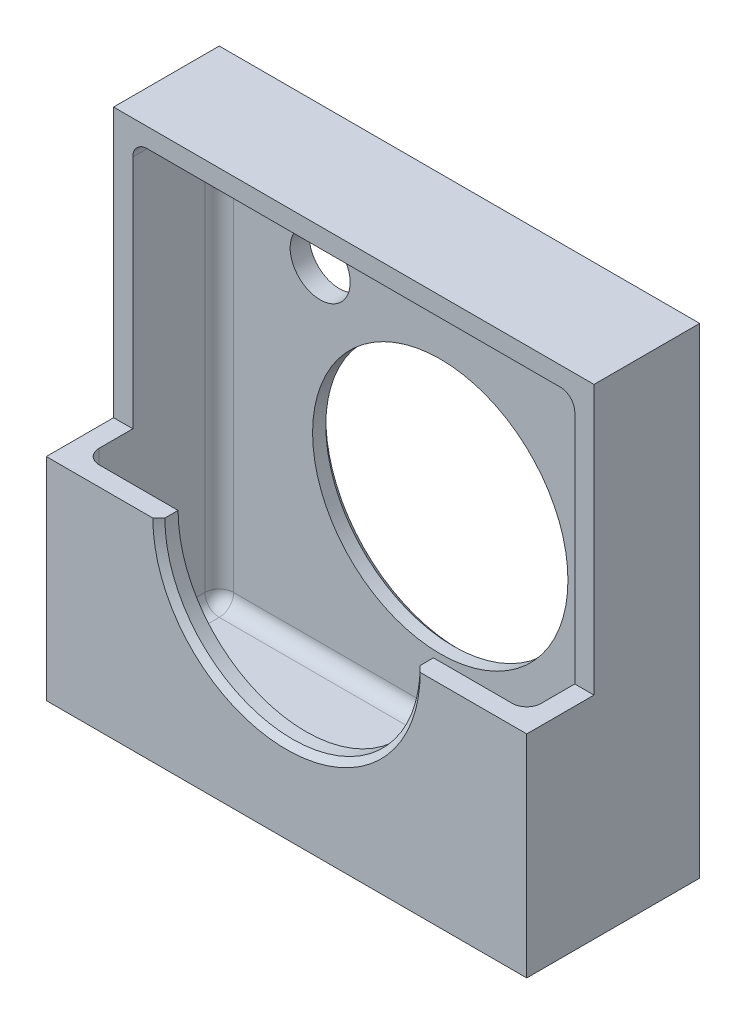
from build123d import *

# Parameters (mm, degrees)
SKETCH1_W          = 50.8
SKETCH1_H          = 50.8
MAIN_BODY_DEPTH    = 18.288
SKETCH2_W          = 7.112
SKETCH2_H          = 28.448
FRONT_CUT_DEPTH    = 75.133197314
SHELL1_T           = -2.032
SKETCH3_R          = 13.5001
CENTER_HOLE_DEPTH  = 75.133197314
FILL060_VERT_R     = 1.524
FILL060_TB_R       = 1.524
CHAM025_SIZE       = 0.635
KEYED_HOLE_1_DEPTH = 58.653742931


with BuildPart() as part:
    # Sketch1 → main body (new body)
    with BuildSketch(Plane.XY):
        with Locations((25.4, 25.4)):
            Rectangle(SKETCH1_W, SKETCH1_H)
    extrude(amount=MAIN_BODY_DEPTH)

    # Sketch2 → front cut (cut, through all)
    with BuildSketch(Plane(origin=(50.8, 0, 0), x_dir=(0, 0, -1), z_dir=(1, 0, 0))):
        with Locations((-14.732, 36.576)):
            Rectangle(SKETCH2_W, SKETCH2_H)
    extrude(amount=-FRONT_CUT_DEPTH, mode=Mode.SUBTRACT)

    # Shell1
    shell1_openings = [part.faces().sort_by_distance(p)[0] for p in [
        (25.4, 22.352, 14.732),
        (25.4, 36.576, 11.176),
    ]]
    offset(amount=SHELL1_T, openings=shell1_openings, kind=Kind.INTERSECTION)

    # Sketch3 → center hole (cut, through all)
    with BuildSketch(Plane.XY):
        with Locations((25.4, 22.352)):
            Circle(SKETCH3_R)
    extrude(amount=CENTER_HOLE_DEPTH, mode=Mode.SUBTRACT)

    # fill060.vert
    fill060_vert_edges = [part.edges().sort_by_distance(p)[0] for p in [
        (2.032, 12.192, 16.256),
        (48.768, 12.192, 16.256),
        (2.032, 25.4, 2.032),
        (48.768, 25.4, 2.032),
    ]]
    fillet(fill060_vert_edges, radius=FILL060_VERT_R)

    # fill060.tb
    fill060_tb_edges = [part.edges().sort_by_distance(p)[0] for p in [
        (48.768, 48.768, 7.366),
        (2.032, 48.768, 7.366),
        (48.321630735, 48.768, 2.478369265),
        (2.478369265, 48.768, 2.478369265),
        (25.4, 48.768, 2.032),
        (25.4, 2.032, 2.032),
        (2.478369265, 2.032, 2.478369265),
        (48.321630735, 2.032, 2.478369265),
        (2.032, 2.032, 9.144),
        (48.768, 2.032, 9.144),
        (2.478369265, 2.032, 15.809630735),
        (48.321630735, 2.032, 15.809630735),
        (25.4, 2.032, 16.256),
    ]]
    fillet(fill060_tb_edges, radius=FILL060_TB_R)

    # cham025
    cham025_edges = [part.edges().sort_by_distance(p)[0] for p in [
        (25.4, 8.8519, 18.288),
        (11.8999, 22.352, 0),
    ]]
    chamfer(cham025_edges, length=CHAM025_SIZE)

    # Sketch6 → Keyed Hole 1 (cut, through all)
    with BuildSketch(Plane(origin=(13.426773448, 39.909210303, 0), x_dir=(0, 1, 0), z_dir=(0, 0, -1))):
        with BuildLine():
            Line((1.238789697, 0.162226552), (2.635789697, 0.162226552))
            Line((2.635789697, 0.162226552), (2.635789697, -1.615773448))
            Line((2.635789697, -1.615773448), (1.238789697, -1.615773448))
            ThreePointArc((1.238789697, -1.615773448), (-4.984210303, -0.726773448), (1.238789697, 0.162226552))
        make_face()
    extrude(amount=-KEYED_HOLE_1_DEPTH, mode=Mode.SUBTRACT)


solid = part.part
